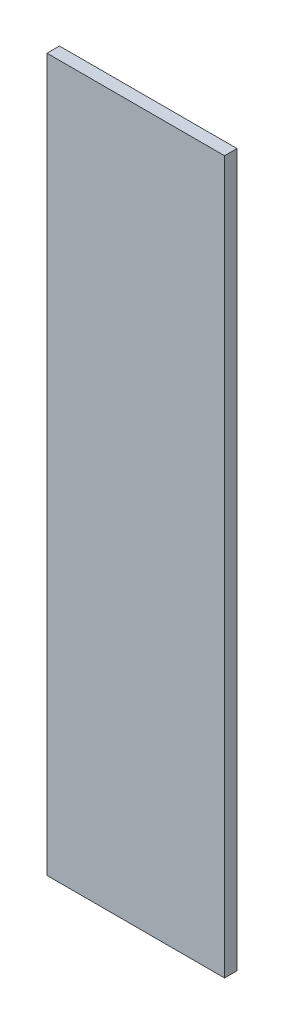
from build123d import *

# Parameters (mm, degrees)
SKETCH1_W           = 28.5
SKETCH1_H           = 114.3
BOSS_EXTRUDE1_DEPTH = 2


with BuildPart() as part:
    # Sketch1 → Boss-Extrude1 (new body)
    with BuildSketch(Plane.XY):
        with Locations((-78.123529412, 6.723529412)):
            Rectangle(SKETCH1_W, SKETCH1_H)
    extrude(amount=BOSS_EXTRUDE1_DEPTH)


solid = part.part
